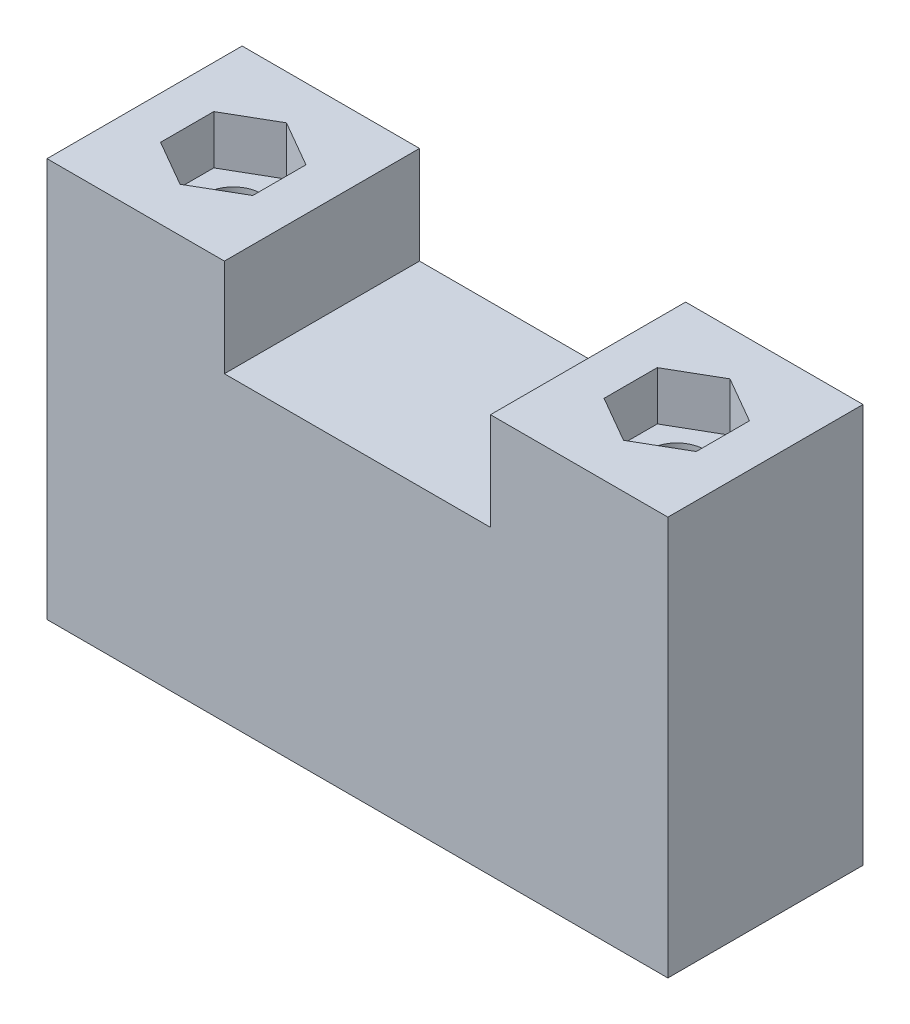
from build123d import *

# Parameters (mm, degrees)
SKETCH1_W           = 70
SKETCH1_H           = 22
BOSS_EXTRUDE1_DEPTH = 45
SKETCH2_W           = 30
SKETCH2_H           = 22
CUT_EXTRUDE1_DEPTH  = 11
SKETCH3_R           = 3.175
CUT_EXTRUDE2_DEPTH  = 69
CUT_EXTRUDE3_DEPTH  = 5.5


with BuildPart() as part:
    # Sketch1 → Boss-Extrude1 (new body)
    with BuildSketch(Plane(origin=(0, 0, 0), x_dir=(1, 0, 0), z_dir=(0, 1, 0))):
        with Locations((35, 11)):
            Rectangle(SKETCH1_W, SKETCH1_H)
    extrude(amount=BOSS_EXTRUDE1_DEPTH)

    # Sketch2 → Cut-Extrude1 (cut)
    with BuildSketch(Plane(origin=(0, 45, 0), x_dir=(1, 0, 0), z_dir=(0, 1, 0))):
        with Locations((35, 11)):
            Rectangle(SKETCH2_W, SKETCH2_H)
    extrude(amount=-CUT_EXTRUDE1_DEPTH, mode=Mode.SUBTRACT)

    # Sketch3 → Cut-Extrude2 (cut)
    with BuildSketch(Plane(origin=(0, 45, 0), x_dir=(1, 0, 0), z_dir=(0, 1, 0))):
        with Locations((10, 11)):
            Circle(SKETCH3_R)
        with Locations((60, 11)):
            Circle(SKETCH3_R)
    extrude(amount=-CUT_EXTRUDE2_DEPTH, mode=Mode.SUBTRACT)

    # Sketch4 → Cut-Extrude3 (cut)
    with BuildSketch(Plane(origin=(0, 45, 0), x_dir=(1, 0, 0), z_dir=(0, 1, 0))):
        Polygon((10, 17), (4.803847577, 14), (4.803847577, 8), (10, 5), (15.196152423, 8), (15.196152423, 14), align=None)
        Polygon((54.803847577, 14), (60, 17), (65.196152423, 14), (65.196152423, 8), (60, 5), (54.803847577, 8), align=None)
    extrude(amount=-CUT_EXTRUDE3_DEPTH, mode=Mode.SUBTRACT)


solid = part.part
